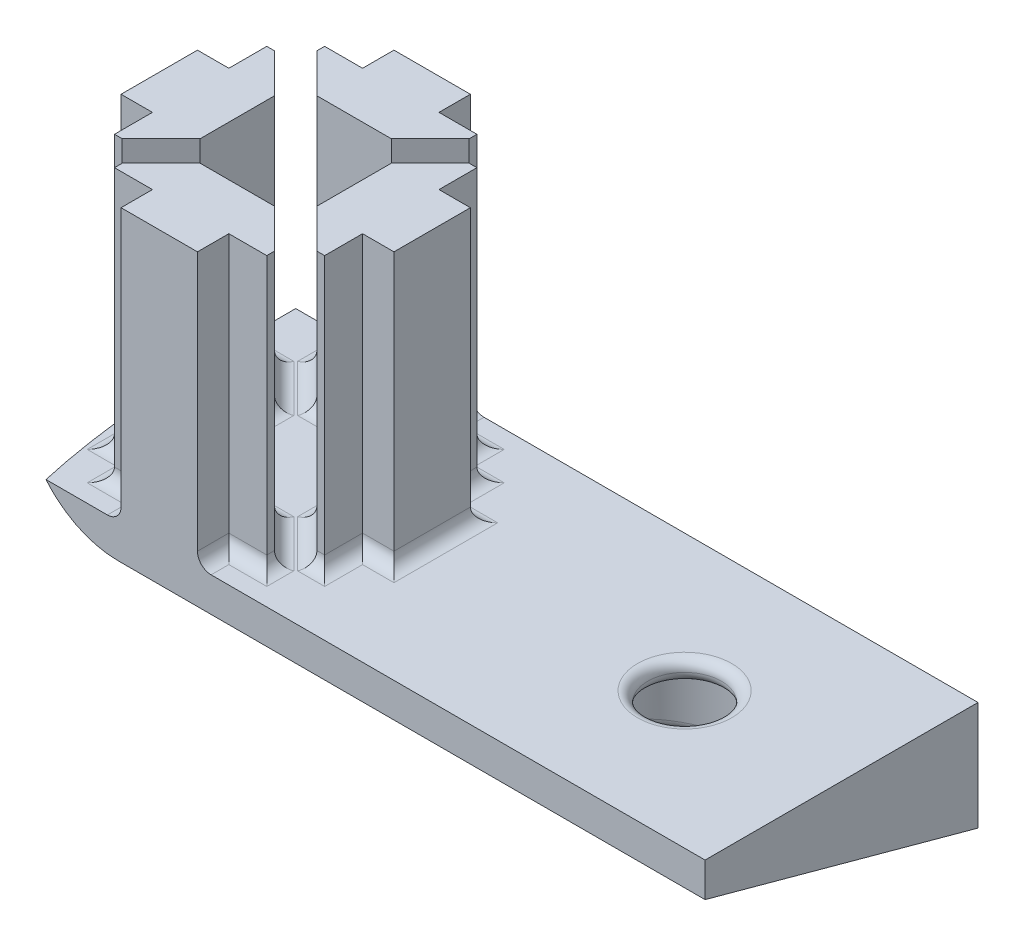
from build123d import *

# Parameters (mm, degrees)
BOSS_EXTRUDE1_DEPTH   = 20
BOSS_EXTRUDE1_2_DEPTH = 20
BOSS_EXTRUDE1_3_DEPTH = 20
BOSS_EXTRUDE1_4_DEPTH = 20
SKETCH2_W             = 20
SKETCH2_H             = 20
BOSS_EXTRUDE2_DEPTH   = 20
CUT_EXTRUDE1_DEPTH    = 31
BOSS_EXTRUDE3_DEPTH   = 30
SKETCH5_R             = 2.7
CUT_EXTRUDE2_DEPTH    = 30
SKETCH6_R             = 5
CUT_EXTRUDE3_DEPTH    = 30
FILLET1_R             = 7
FILLET3_R             = 1
FILLET4_R             = 0.75


# Some blends are built 0.0001 mm under size
with BuildPart() as part:
    # Sketch1 → Boss-Extrude1 (new body)
    with BuildSketch(Plane(origin=(0, 0, 0), x_dir=(1, 0, 0), z_dir=(0, 1, 0))):
        Polygon((-10, -2.8), (-10, 2.8), (-7.7, 2.8), (-7.7, 5.58), (-7.135634919, 5.58), (-4.28, 2.724365081), (-4.28, -2.724365081), (-7.135634919, -5.58), (-7.7, -5.58), (-7.7, -2.8), align=None)
    extrude(amount=BOSS_EXTRUDE1_DEPTH)



with BuildPart() as body_2:
    # Sketch1 → Boss-Extrude1 2 (new body)
    with BuildSketch(Plane(origin=(0, 0, 0), x_dir=(1, 0, 0), z_dir=(0, 1, 0))):
        Polygon((10, 2.8), (7.7, 2.8), (7.7, 5.58), (7.135634919, 5.58), (4.28, 2.724365081), (4.28, -2.724365081), (7.135634919, -5.58), (7.7, -5.58), (7.7, -2.8), (10, -2.8), align=None)
    extrude(amount=BOSS_EXTRUDE1_2_DEPTH)


with BuildPart() as body_3:
    # Sketch1 → Boss-Extrude1 3 (new body)
    with BuildSketch(Plane(origin=(0, 0, 0), x_dir=(1, 0, 0), z_dir=(0, 1, 0))):
        Polygon((2.8, -10), (-2.8, -10), (-2.8, -7.7), (-5.58, -7.7), (-5.58, -7.135634919), (-2.724365081, -4.28), (2.724365081, -4.28), (5.58, -7.135634919), (5.58, -7.7), (2.8, -7.7), align=None)
    extrude(amount=BOSS_EXTRUDE1_3_DEPTH)


with BuildPart() as body_4:
    # Sketch1 → Boss-Extrude1 4 (new body)
    with BuildSketch(Plane(origin=(0, 0, 0), x_dir=(1, 0, 0), z_dir=(0, 1, 0))):
        Polygon((-2.8, 10), (-2.8, 7.7), (-5.58, 7.7), (-5.58, 7.135634919), (-2.724365081, 4.28), (2.724365081, 4.28), (5.58, 7.135634919), (5.58, 7.7), (2.8, 7.7), (2.8, 10), align=None)
    extrude(amount=BOSS_EXTRUDE1_4_DEPTH)


with BuildPart() as part_1:
    add(part.part)

    add(body_2.part)  # Boss-Extrude2 merges body 2

    add(body_3.part)  # Boss-Extrude2 merges body 3

    add(body_4.part)  # Boss-Extrude2 merges body 4
    # Sketch2 → Boss-Extrude2 (add)
    with BuildSketch(Plane.XZ):
        Rectangle(SKETCH2_W, SKETCH2_H)
    extrude(amount=BOSS_EXTRUDE2_DEPTH)

    # Sketch3 → Cut-Extrude1 (cut, through all)
    with BuildSketch(Plane(origin=(10, 0, 0), x_dir=(0, 0, -1), z_dir=(1, 0, 0))):
        Polygon((10.596673941, -8.137212268), (10.596673941, -38.345549702), (-10.411138478, -38.345549702), (-10.411138478, -2.402671747), align=None)
    extrude(amount=-CUT_EXTRUDE1_DEPTH, mode=Mode.SUBTRACT)

    # Sketch4 → Boss-Extrude3 (add)
    with BuildSketch(Plane(origin=(10, 0, 0), x_dir=(0, 0, -1), z_dir=(1, 0, 0))):
        Polygon((10, -7.974337104), (10, 0), (-10, 0), (-10, -2.51490096), align=None)
    extrude(amount=BOSS_EXTRUDE3_DEPTH)

    # Sketch5 → Cut-Extrude2 (cut)
    with BuildSketch(Plane(origin=(0, 0, 0), x_dir=(1, 0, 0), z_dir=(0, 1, 0))):
        with Locations(Location((28.5, 0, 0), (0, 0, 270))):
            Circle(SKETCH5_R)
    extrude(amount=-CUT_EXTRUDE2_DEPTH, mode=Mode.SUBTRACT)

    # Sketch6 → Cut-Extrude3 (cut)
    with BuildSketch(Plane(origin=(0, -1.5, 0), x_dir=(1, 0, 0), z_dir=(0, 1, 0))):
        with Locations(Location((28.5, 0, 0), (0, 0, 270))):
            Circle(SKETCH6_R)
    extrude(amount=-CUT_EXTRUDE3_DEPTH, mode=Mode.SUBTRACT)

    # Fillet1
    # the kernel refuses this fillet: 7 mm, written as the material it takes off along each edge
    with BuildSketch(Plane(origin=(-10, -12.582734088, -26.882318479), x_dir=(0, 0.9647039130954433, -0.26333697054978655), z_dir=(0, 0.26333697054978655, 0.9647039130954435))) as fillet1_piece_1:
        with BuildLine():
            CenterArc((FILLET1_R, -FILLET1_R), FILLET1_R, 90, 90)
            Line((0, -FILLET1_R), (0, 0))
            Line((0, 0), (FILLET1_R, 0))
        make_face()
    extrude(amount=55.731749637, mode=Mode.SUBTRACT)

    # Fillet3
    fillet3_edges = [part_1.edges().sort_by_distance(p)[0] for p in [
        (4.152182541, 0, -5.707817459),
        (5.58, 0, -7.417817459),
        (4.19, 0, -7.7),
        (2.8, 0, -8.85),
        (-2.8, 0, -8.85),
        (-4.19, 0, -7.7),
        (-5.58, 0, -7.417817459),
        (-4.152182541, 0, -5.707817459),
        (0, 0, -4.28),
        (4.28, 0, 0),
        (5.707817459, 0, -4.152182541),
        (7.417817459, 0, -5.58),
        (7.7, 0, -4.19),
        (8.85, 0, -2.8),
        (10, 0, 0),
        (8.85, 0, 2.8),
        (7.7, 0, 4.19),
        (5.707817459, 0, 4.152182541),
        (7.417817459, 0, 5.58),
        (2.8, 0, 8.85),
        (4.19, 0, 7.7),
        (5.58, 0, 7.417817459),
        (4.152182541, 0, 5.707817459),
        (0, 0, 4.28),
        (-4.152182541, 0, 5.707817459),
        (-5.58, 0, 7.417817459),
        (-2.8, 0, 8.85),
        (-4.19, 0, 7.7),
        (-8.583774042, 0, 2.8),
        (-7.7, 0, 4.19),
        (-7.417817459, 0, 5.58),
        (-5.707817459, 0, 4.152182541),
        (-4.28, 0, 0),
        (-5.707817459, 0, -4.152182541),
        (-7.417817459, 0, -5.58),
        (-7.7, 0, -4.19),
        (-8.79791333, 0, -2.8),
    ]]
    fillet(fillet3_edges, radius=FILLET3_R)

    # Fillet4
    fillet4_edges = [part_1.edges().sort_by_distance(p)[0] for p in [
        (28.5, 0, -2.7),
        (28.5, -6.609478068, -5),
        (28.5, -1.5, -5),
        (28.5, -1.5, -2.7),
    ]]
    fillet(fillet4_edges, radius=FILLET4_R - 0.0001)  # a hair under: the kernel refuses the full size


solid = part_1.part
